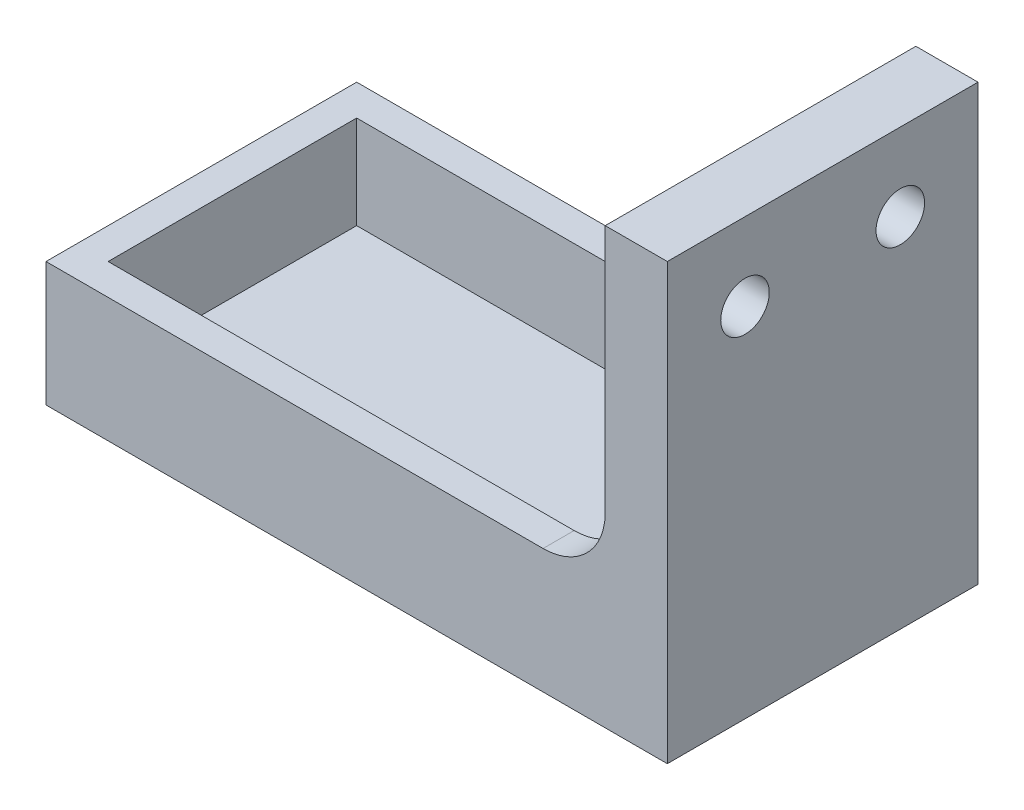
from build123d import *

# Parameters (mm, degrees)
SKETCH1_W               = 45.72
SKETCH1_H               = 25.4
BOSS_EXTRUDE1_DEPTH     = 10.16
SHELL1_T                = -2.54
SKETCH2_W               = 25.4
SKETCH2_H               = 35.56
BOSS_EXTRUDE2_DEPTH     = 5.08
FILLET1_R               = 5.08
CUT_EXTRUDE1_DEPTH      = 64.245489958
CUT_EXTRUDE1_DEPTH_BACK = 64.245489958
SKETCH3_R               = 1.984375


with BuildPart() as part:
    # Sketch1 → Boss-Extrude1 (new body)
    with BuildSketch(Plane(origin=(0, 0, 0), x_dir=(1, 0, 0), z_dir=(0, 1, 0))):
        with Locations((0, 12.7)):
            Rectangle(SKETCH1_W, SKETCH1_H)
    extrude(amount=BOSS_EXTRUDE1_DEPTH)

    # Shell1
    shell1_openings = [part.faces().sort_by_distance(p)[0] for p in [
        (0, 10.16, -12.7),
    ]]
    offset(amount=SHELL1_T, openings=shell1_openings, kind=Kind.INTERSECTION)

    # Sketch2 → Boss-Extrude2 (add)
    with BuildSketch(Plane(origin=(22.86, 0, 0), x_dir=(0, 0, -1), z_dir=(1, 0, 0))):
        with Locations((12.7, 17.78)):
            Rectangle(SKETCH2_W, SKETCH2_H)
    extrude(amount=BOSS_EXTRUDE2_DEPTH)

    # Fillet1
    # the kernel refuses this fillet: 5.08 mm, written as the material it adds along each edge
    with BuildSketch(Plane(origin=(22.86, 10.16, -25.4), x_dir=(0, 1, 0), z_dir=(0, 0, 1))) as fillet1_piece_1_section:
        with BuildLine():
            CenterArc((FILLET1_R, FILLET1_R), FILLET1_R, 180, 90)
            Line((0, FILLET1_R), (0, 0))
            Line((0, 0), (FILLET1_R, 0))
        make_face()
    fillet1_piece_1 = extrude(amount=25.4, mode=Mode.PRIVATE)
    fillet1_piece_1 = split(fillet1_piece_1, bisect_by=Plane(origin=(22.024889837, 11.456009905, -22.86), z_dir=(0, 0, -1)), keep=Keep.TOP, mode=Mode.PRIVATE)
    fillet1_piece_1 = split(fillet1_piece_1, bisect_by=Plane(origin=(20.32, 11.456009905, -24.13), z_dir=(1, 0, 0)), keep=Keep.TOP, mode=Mode.PRIVATE)
    add(fillet1_piece_1)
    with BuildSketch(Plane(origin=(22.86, 10.16, -25.4), x_dir=(0, 1, 0), z_dir=(0, 0, 1))) as fillet1_piece_2_section:
        with BuildLine():
            CenterArc((FILLET1_R, FILLET1_R), FILLET1_R, 180, 90)
            Line((0, FILLET1_R), (0, 0))
            Line((0, 0), (FILLET1_R, 0))
        make_face()
    fillet1_piece_2 = extrude(amount=25.4, mode=Mode.PRIVATE)
    fillet1_piece_2 = split(fillet1_piece_2, bisect_by=Plane(origin=(19.490686015, 10.281962579, -22.86), z_dir=(0, 0, -1)), keep=Keep.TOP, mode=Mode.PRIVATE)
    fillet1_piece_2 = split(fillet1_piece_2, bisect_by=Plane(origin=(20.32, 10.281962579, -24.13), z_dir=(-1, 0, 0)), keep=Keep.TOP, mode=Mode.PRIVATE)
    add(fillet1_piece_2)
    with BuildSketch(Plane(origin=(22.86, 10.16, -25.4), x_dir=(0, 1, 0), z_dir=(0, 0, 1))) as fillet1_piece_3_section:
        with BuildLine():
            CenterArc((FILLET1_R, FILLET1_R), FILLET1_R, 180, 90)
            Line((0, FILLET1_R), (0, 0))
            Line((0, 0), (FILLET1_R, 0))
        make_face()
    fillet1_piece_3 = extrude(amount=25.4, mode=Mode.PRIVATE)
    fillet1_piece_3 = split(fillet1_piece_3, bisect_by=Plane(origin=(22.024889837, 11.456009905, -22.86), z_dir=(0, 0, 1)), keep=Keep.TOP, mode=Mode.PRIVATE)
    fillet1_piece_3 = split(fillet1_piece_3, bisect_by=Plane(origin=(22.024889837, 11.456009905, -2.54), z_dir=(0, 0, -1)), keep=Keep.TOP, mode=Mode.PRIVATE)
    fillet1_piece_3 = split(fillet1_piece_3, bisect_by=Plane(origin=(20.32, 11.456009905, -12.7), z_dir=(1, 0, 0)), keep=Keep.TOP, mode=Mode.PRIVATE)
    add(fillet1_piece_3)
    with BuildSketch(Plane(origin=(22.86, 10.16, -25.4), x_dir=(0, 1, 0), z_dir=(0, 0, 1))) as fillet1_piece_4_section:
        with BuildLine():
            CenterArc((FILLET1_R, FILLET1_R), FILLET1_R, 180, 90)
            Line((0, FILLET1_R), (0, 0))
            Line((0, 0), (FILLET1_R, 0))
        make_face()
    fillet1_piece_4 = extrude(amount=25.4, mode=Mode.PRIVATE)
    fillet1_piece_4 = split(fillet1_piece_4, bisect_by=Plane(origin=(22.024889837, 11.456009905, -2.54), z_dir=(0, 0, 1)), keep=Keep.TOP, mode=Mode.PRIVATE)
    fillet1_piece_4 = split(fillet1_piece_4, bisect_by=Plane(origin=(20.32, 11.456009905, -1.27), z_dir=(1, 0, 0)), keep=Keep.TOP, mode=Mode.PRIVATE)
    add(fillet1_piece_4)
    with BuildSketch(Plane(origin=(22.86, 10.16, -25.4), x_dir=(0, 1, 0), z_dir=(0, 0, 1))) as fillet1_piece_5_section:
        with BuildLine():
            CenterArc((FILLET1_R, FILLET1_R), FILLET1_R, 180, 90)
            Line((0, FILLET1_R), (0, 0))
            Line((0, 0), (FILLET1_R, 0))
        make_face()
    fillet1_piece_5 = extrude(amount=25.4, mode=Mode.PRIVATE)
    fillet1_piece_5 = split(fillet1_piece_5, bisect_by=Plane(origin=(19.490686015, 10.281962579, -2.54), z_dir=(0, 0, 1)), keep=Keep.TOP, mode=Mode.PRIVATE)
    fillet1_piece_5 = split(fillet1_piece_5, bisect_by=Plane(origin=(20.32, 10.281962579, -1.27), z_dir=(-1, 0, 0)), keep=Keep.TOP, mode=Mode.PRIVATE)
    add(fillet1_piece_5)

    # Sketch3 → Cut-Extrude1 (cut, two sides: drawn at the far end of the back side and taken through both)
    with BuildSketch(Plane.ZY.offset(-22.86).offset(-CUT_EXTRUDE1_DEPTH_BACK)):
        with Locations((-19.05, 29.21)):
            Circle(SKETCH3_R)
        with Locations((-6.35, 29.21)):
            Circle(SKETCH3_R)
    extrude(amount=CUT_EXTRUDE1_DEPTH + CUT_EXTRUDE1_DEPTH_BACK, mode=Mode.SUBTRACT)


solid = part.part
